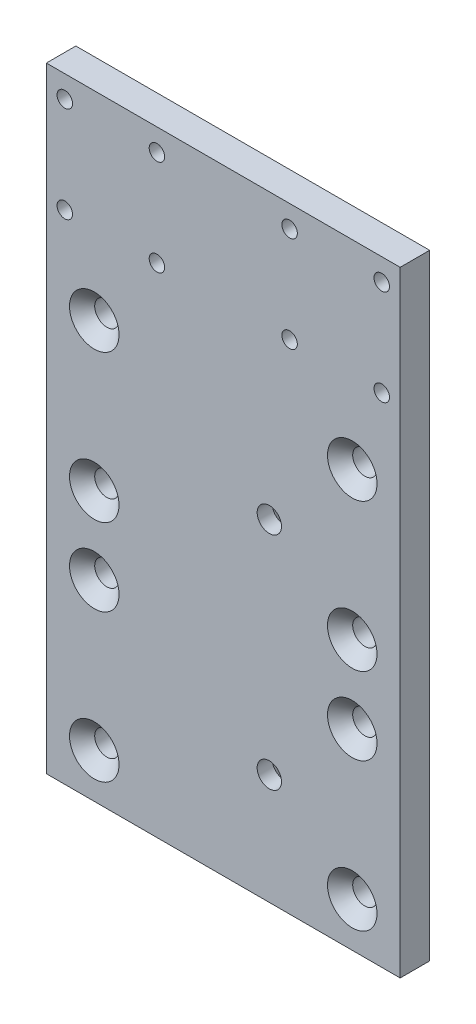
from build123d import *

# Parameters (mm, degrees)
SKETCH1_W                                            = 96
SKETCH1_H                                            = 120
BOSS_EXTRUDE1_DEPTH                                  = 8
CSK_FOR_M6_HEX_SOCKET_COUNTERSUNK_CAP_SC_D           = 6.6
CSK_FOR_M6_HEX_SOCKET_COUNTERSUNK_CAP_SC_CSINK_D     = 13.44
CSK_FOR_M6_HEX_SOCKET_COUNTERSUNK_CAP_SC_CSINK_ANGLE = 90
SKETCH4_W                                            = 15
SKETCH4_H                                            = 120
BOSS_EXTRUDE2_DEPTH                                  = 25
M6_TAPPED_HOLE1_D                                    = 5
SKETCH8_W                                            = 96
SKETCH8_H                                            = 47
BOSS_EXTRUDE4_DEPTH                                  = 8
M5_TAPPED_HOLE1_D                                    = 4.2
CSK_FOR_M6_HEX_SOCKET_COUNTERSUNK_CA_2_A_COUNT       = 2
CSK_FOR_M6_HEX_SOCKET_COUNTERSUNK_CA_2_A_PITCH       = 60
SKETCH16_W                                           = 2.5
SKETCH16_H                                           = 25
M6_TAPPED_HOLE2_AT_2_COUNT                           = 2
M6_TAPPED_HOLE2_AT_2_PITCH                           = 60


# Read off the part's stored shape, not the designer's step: Split1
with BuildPart() as part:
    # Sketch1 → Boss-Extrude1 (new body)
    with BuildSketch(Plane.XY):
        Rectangle(SKETCH1_W, SKETCH1_H)
    extrude(amount=BOSS_EXTRUDE1_DEPTH)

    # CSK for M6 Hex Socket Countersunk Cap Sc (through all)
    with Locations(Plane.XY.offset(8)):
        with Locations((-35, 53), (-35, 13), (-35, -8), (-35, -48)):
            csk_for_m6_hex_socket_countersunk_cap_sc = CounterSinkHole(CSK_FOR_M6_HEX_SOCKET_COUNTERSUNK_CAP_SC_D / 2, CSK_FOR_M6_HEX_SOCKET_COUNTERSUNK_CAP_SC_CSINK_D / 2, counter_sink_angle=CSK_FOR_M6_HEX_SOCKET_COUNTERSUNK_CAP_SC_CSINK_ANGLE)

    # Sketch4 → Boss-Extrude2 (add)
    with BuildSketch(Plane.XY.offset(8)):
        with Locations((12.5, 0)):
            Rectangle(SKETCH4_W, SKETCH4_H)
    extrude(amount=BOSS_EXTRUDE2_DEPTH)

    # M6 Tapped Hole1 (through all)
    with Locations(Plane.ZY.offset(-5)):
        with Locations((20.5, -40), (20.5, 40)):
            Hole(M6_TAPPED_HOLE1_D / 2)

    # Sketch8 → Boss-Extrude4 (add)
    with BuildSketch(Plane.XY.offset(8)):
        with Locations((0, 83.5)):
            Rectangle(SKETCH8_W, SKETCH8_H)
    extrude(amount=-BOSS_EXTRUDE4_DEPTH)

    # M5 Tapped Hole1 (through all)
    with Locations(Plane.XY.offset(8)):
        with Locations((-43, 101), (-43, 75), (-18, 101), (-18, 75), (18, 75), (18, 101), (43, 101), (43, 75)):
            Hole(M5_TAPPED_HOLE1_D / 2)

    # Mirror1: CSK for M6 Hex Socket Countersunk Cap Sc across plane
    add(csk_for_m6_hex_socket_countersunk_cap_sc.mirror(Plane(origin=(0, 0, 0), x_dir=(0, 0, 1), z_dir=(1, 0, 0))), mode=Mode.SUBTRACT)


with BuildPart() as body_2:
    # Split1: the piece on the far side of the plane
    add(part.part)
    split(bisect_by=Plane.XY.offset(8), keep=Keep.BOTTOM)

    # Sketch14 → CSK for M6 Hex Socket Countersunk Ca 2 (revolve, cut)
    with BuildSketch(Plane(origin=(12.5, 30, 0), x_dir=(0, 1, 0), z_dir=(1, 0, 0))):
        Polygon((0, 0), (0, 33), (3.3, 33), (3.3, 3.92), (7.22, 0), align=None)
    csk_for_m6_hex_socket_countersunk_ca_2 = revolve(axis=Axis((12.5, 30, -6.35), (0, 0, 1)), mode=Mode.SUBTRACT)

    # CSK for M6 Hex Socket Countersunk Ca 2 a: CSK for M6 Hex Socket Countersunk Ca 2 ×2
    with Locations(*[(0, -i * CSK_FOR_M6_HEX_SOCKET_COUNTERSUNK_CA_2_A_PITCH, 0) for i in range(1, CSK_FOR_M6_HEX_SOCKET_COUNTERSUNK_CA_2_A_COUNT)]):
        add(csk_for_m6_hex_socket_countersunk_ca_2, mode=Mode.SUBTRACT)


with BuildPart() as part_1:
    add(part.part)

    # Split1
    split(bisect_by=Plane.XY.offset(8), keep=Keep.TOP)

    # Sketch16 → M6 Tapped Hole2 (revolve, cut)
    with BuildSketch(Plane(origin=(12.5, 30, 8), x_dir=(0, 1, 0), z_dir=(1, 0, 0))):
        with Locations((1.25, 12.5)):
            Rectangle(SKETCH16_W, SKETCH16_H)
    m6_tapped_hole2 = revolve(axis=Axis((12.5, 30, 1.65), (0, 0, 1)), mode=Mode.SUBTRACT)

    # M6 Tapped Hole2 at 2: M6 Tapped Hole2 ×2
    with Locations(*[(0, -i * M6_TAPPED_HOLE2_AT_2_PITCH, 0) for i in range(1, M6_TAPPED_HOLE2_AT_2_COUNT)]):
        add(m6_tapped_hole2, mode=Mode.SUBTRACT)


solid = body_2.part
